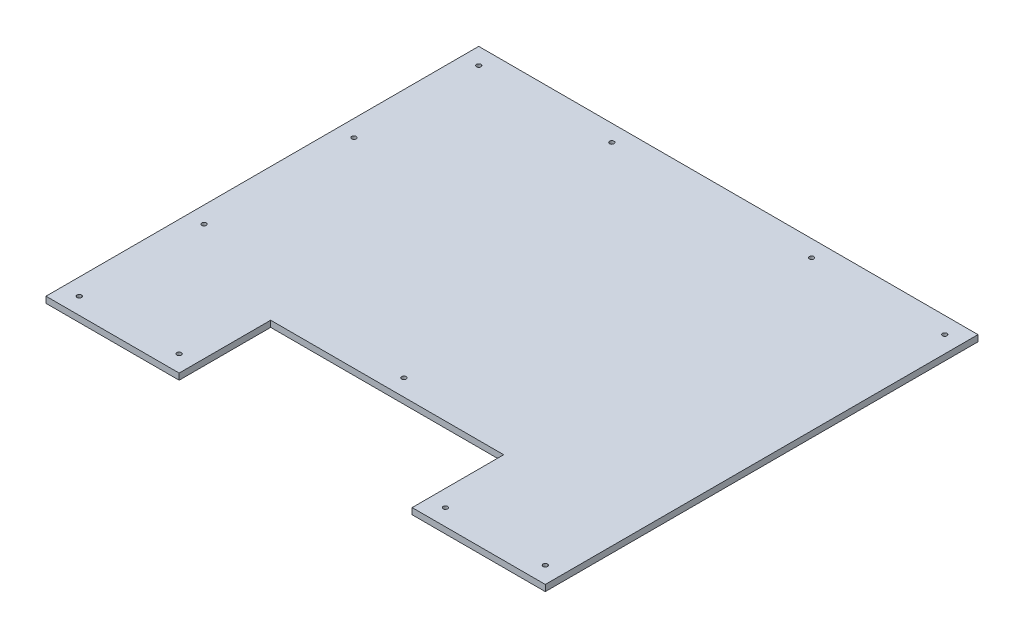
from build123d import *

# Parameters (mm, degrees)
BOSS_EXTRUDE1_DEPTH  = 4.7625
M3_CLEARANCE_HOLE1_D = 3.4


with BuildPart() as part:
    # Sketch1 → Boss-Extrude1 (new body)
    with BuildSketch(Plane(origin=(0, 0, 0), x_dir=(1, 0, 0), z_dir=(0, 1, 0))):
        Polygon((-190.5, -165.1), (-88.9, -165.1), (-88.9, -95.25), (88.9, -95.25), (88.9, -165.1), (190.5, -165.1), (190.5, 165.1), (-190.5, 165.1), align=None)
    extrude(amount=BOSS_EXTRUDE1_DEPTH)

    # M3 Clearance Hole1 (through all)
    with Locations(Plane(origin=(-76.2, 4.7625, -152.4), x_dir=(0, 0, 1), z_dir=(0, 1, 0))):
        with Locations((0, 0), (0, 152.4), (234.95, 76.2), (304.8, -25.4), (304.8, -101.6), (0, -101.6), (0, 254), (304.8, 254), (304.8, 177.8), (95.25, -101.6), (209.55, -101.6)):
            Hole(M3_CLEARANCE_HOLE1_D / 2)


solid = part.part
